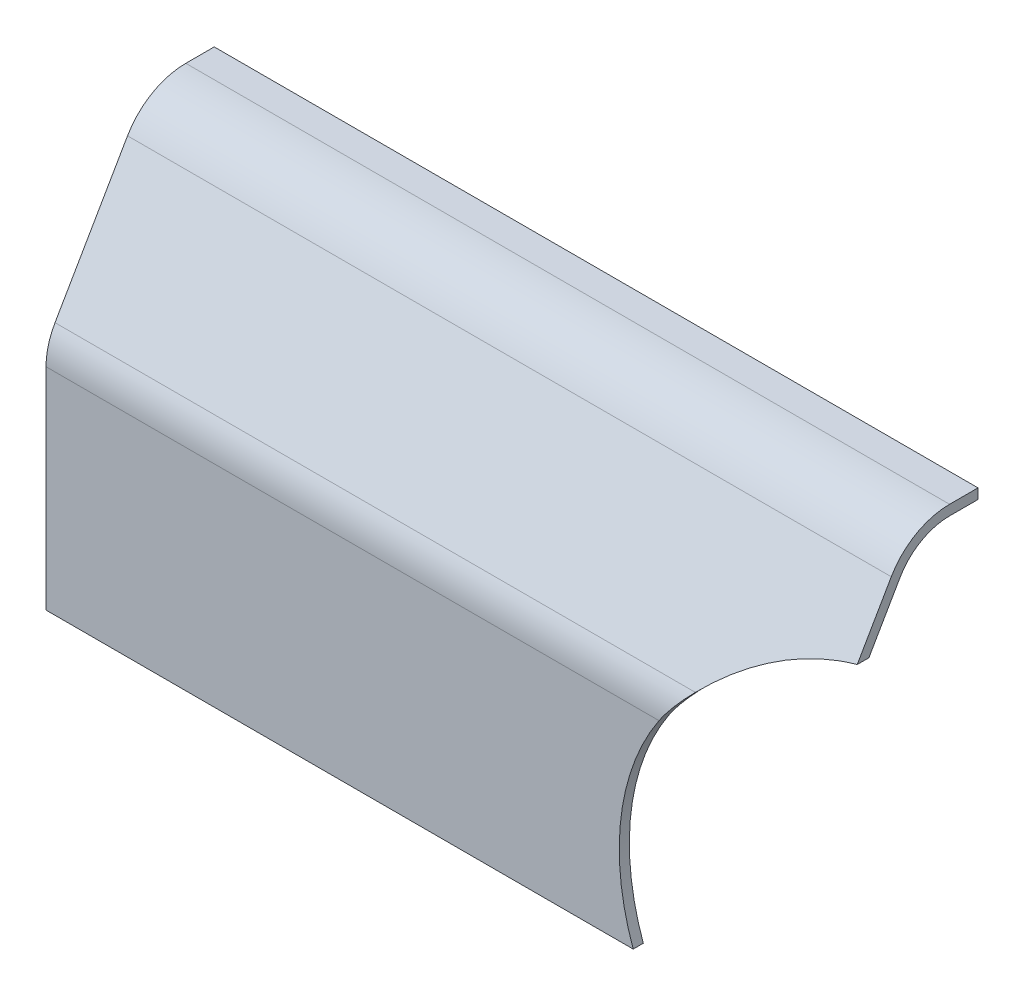
from build123d import *

# Parameters (mm, degrees)
SALIENTE_EXTRUIR1_DEPTH = 113.5
REDONDEO1_R             = 20
REDONDEO2_R             = 20
REDONDEO3_R             = 17
REDONDEO4_R             = 17
CROQUIS2_R              = 70
CORTAR_EXTRUIR1_DEPTH   = 173.54859401


with BuildPart() as part:
    # Croquis1 → Saliente-Extruir1 (new, symmetric)
    with BuildSketch(Plane(origin=(0, 0, 0), x_dir=(0, 0, -1), z_dir=(1, 0, 0))):
        Polygon((0, 0), (0, 67.196152423), (28.732050808, 116.961524227), (47, 116.961524227), (47, 119.961524227), (27, 119.961524227), (-3, 68), (-3, 0), align=None)
    extrude(amount=SALIENTE_EXTRUIR1_DEPTH, both=True)

    # Redondeo1
    redondeo1_edges = [part.edges().sort_by_distance(p)[0] for p in [
        (0, 68, 3),
    ]]
    fillet(redondeo1_edges, radius=REDONDEO1_R)

    # Redondeo2
    redondeo2_edges = [part.edges().sort_by_distance(p)[0] for p in [
        (0, 119.961524227, -27),
    ]]
    fillet(redondeo2_edges, radius=REDONDEO2_R)

    # Redondeo3
    redondeo3_edges = [part.edges().sort_by_distance(p)[0] for p in [
        (0, 116.961524227, -28.732050808),
    ]]
    fillet(redondeo3_edges, radius=REDONDEO3_R)

    # Redondeo4
    redondeo4_edges = [part.edges().sort_by_distance(p)[0] for p in [
        (0, 67.196152423, 0),
    ]]
    fillet(redondeo4_edges, radius=REDONDEO4_R)

    # Croquis2 → Cortar-Extruir1 (cut, through all)
    with BuildSketch(Plane.XY.offset(3)):
        with Locations((126.88, 23.721524227)):
            Circle(CROQUIS2_R)
    extrude(amount=-CORTAR_EXTRUIR1_DEPTH, mode=Mode.SUBTRACT)


solid = part.part
